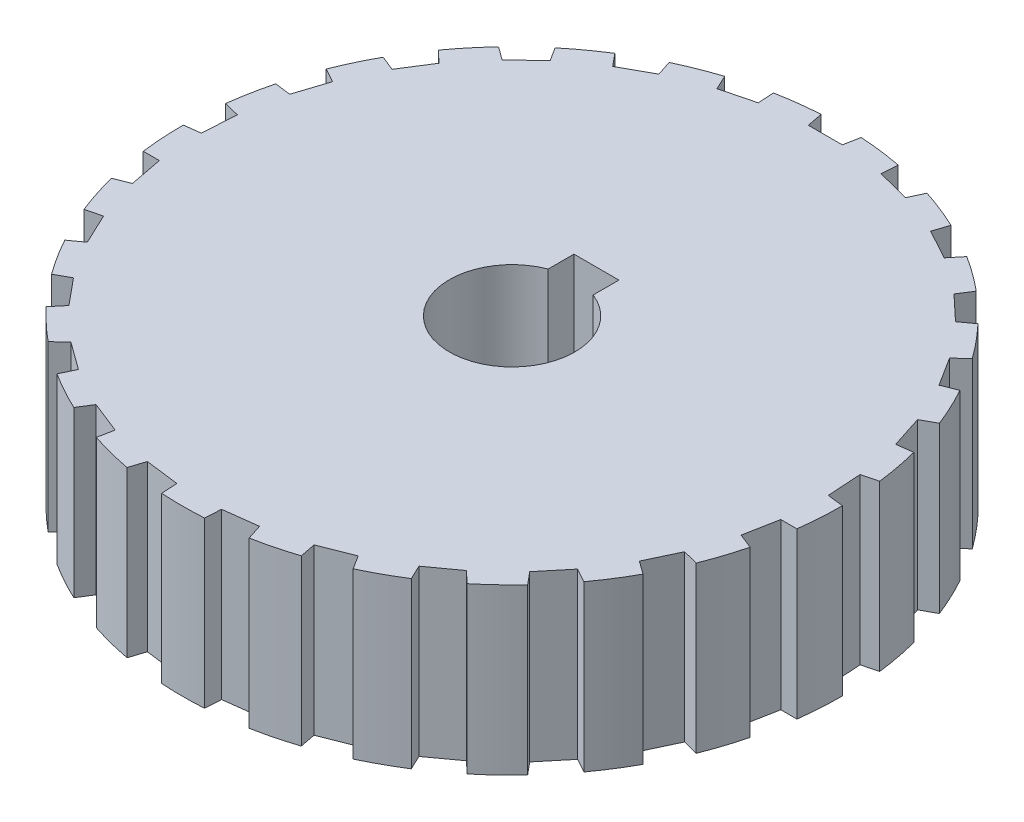
from build123d import *

# Parameters (mm, degrees)
SKETCH5_R           = 38.1
BOSS_EXTRUDE2_DEPTH = 19.05
CUT_EXTRUDE1_DEPTH  = 22.05
CIRPATTERN1_COUNT   = 25
CUT_EXTRUDE2_DEPTH  = 25.4


with BuildPart() as part:
    # Sketch5 → Boss-Extrude2 (new body)
    with BuildSketch(Plane(origin=(0, 0, 0), x_dir=(1, 0, 0), z_dir=(0, 1, 0))):
        Circle(SKETCH5_R)
    extrude(amount=BOSS_EXTRUDE2_DEPTH)

    # Sketch8 → Cut-Extrude1 (cut)
    with BuildSketch(Plane(origin=(0, 19.05, 0), x_dir=(1, 0, 0), z_dir=(0, 1, 0))):
        Polygon((0.008891127, 38.105), (2.332991127, 38.105), (1.974611644, 36.2), (-1.95682939, 36.2), (-2.315208873, 38.105), align=None)
    cut_extrude1 = extrude(amount=-CUT_EXTRUDE1_DEPTH, mode=Mode.SUBTRACT)

    # CirPattern1: Cut-Extrude1 ×25 about axis
    cirpattern1_axis = Axis((0, 19.05, 0), (0, 1, 0))
    for i in range(1, CIRPATTERN1_COUNT):
        add(cut_extrude1.rotate(cirpattern1_axis, i * 360 / CIRPATTERN1_COUNT), mode=Mode.SUBTRACT)

    # Sketch9 → Cut-Extrude2 (cut)
    with BuildSketch(Plane(origin=(0, 19.05, 0), x_dir=(1, 0, 0), z_dir=(0, 1, 0))):
        with BuildLine():
            Line((-2.6, 9.75), (-2.6, 6.767754428))
            ThreePointArc((-2.6, 6.767754428), (0, -7.25), (2.6, 6.767754428))
            Line((2.6, 6.767754428), (2.6, 9.75))
            Line((2.6, 9.75), (-2.6, 9.75))
        make_face()
    extrude(amount=-CUT_EXTRUDE2_DEPTH, mode=Mode.SUBTRACT)


solid = part.part
